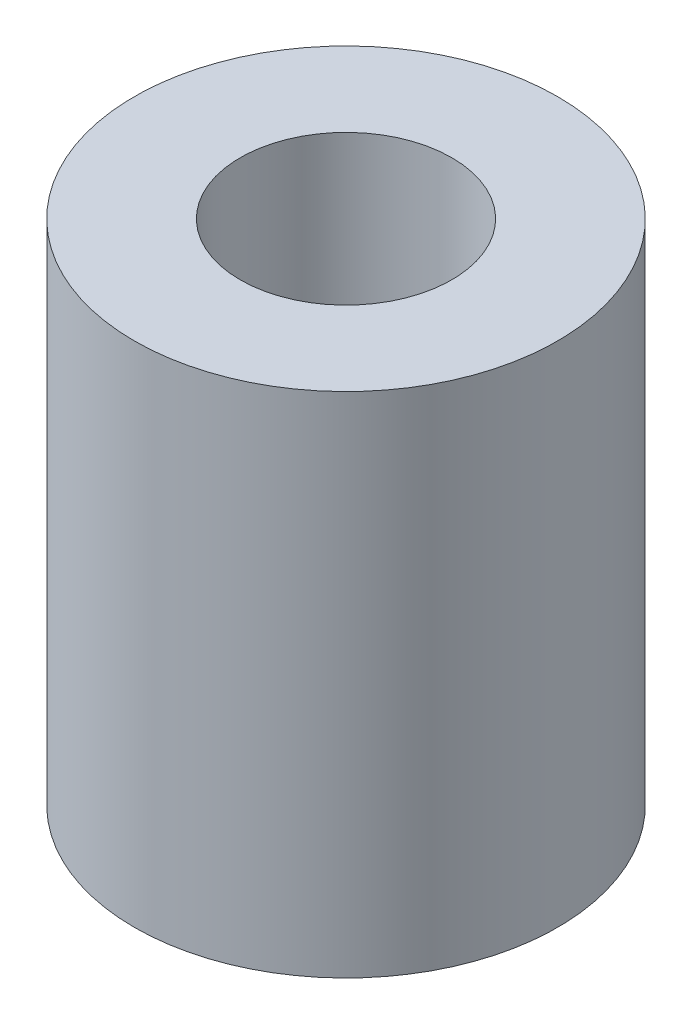
from build123d import *

# Parameters (mm, degrees)
SKETCH1_R             = 2.5
BOSS_EXTRUDE1_DEPTH   = 6
M3X0_5_TAPPED_HOLE1_D = 2.5


with BuildPart() as part:
    # Sketch1 → Boss-Extrude1 (new body)
    with BuildSketch(Plane(origin=(0, 0, 0), x_dir=(1, 0, 0), z_dir=(0, 1, 0))):
        Circle(SKETCH1_R)
    extrude(amount=BOSS_EXTRUDE1_DEPTH)

    # M3x0.5 Tapped Hole1 (through all)
    with Locations(Plane(origin=(0, 6, 0), x_dir=(1, 0, 0), z_dir=(0, 1, 0))):
        with Locations((0, 0)):
            Hole(M3X0_5_TAPPED_HOLE1_D / 2)


solid = part.part
